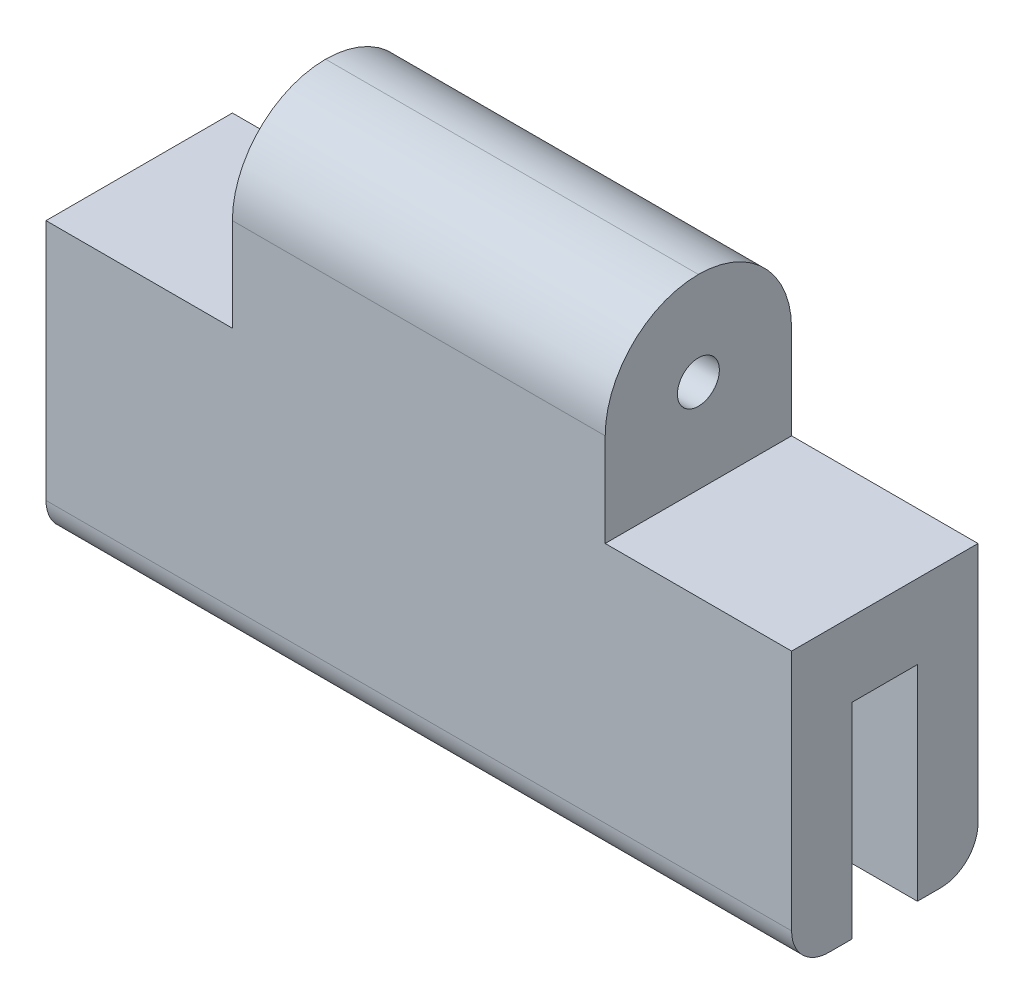
from build123d import *

# Parameters (mm, degrees)
SKETCH1_W           = 80
SKETCH1_H           = 20
BOSS_EXTRUDE1_DEPTH = 30
SKETCH2_W           = 80
SKETCH2_H           = 7
CUT_EXTRUDE1_DEPTH  = 22
SKETCH3_W           = 40
SKETCH3_H           = 20
BOSS_EXTRUDE2_DEPTH = 20
SKETCH4_R           = 2.25
CUT_EXTRUDE2_DEPTH  = 81.622577483
FILLET1_R           = 10
FILLET2_R           = 4


with BuildPart() as part:
    # Sketch1 → Boss-Extrude1 (new body)
    with BuildSketch(Plane(origin=(0, 0, 0), x_dir=(1, 0, 0), z_dir=(0, 1, 0))):
        with Locations((40, -10)):
            Rectangle(SKETCH1_W, SKETCH1_H)
    extrude(amount=BOSS_EXTRUDE1_DEPTH)

    # Sketch2 → Cut-Extrude1 (cut)
    with BuildSketch(Plane(origin=(0, 0, 0), x_dir=(-1, 0, 0), z_dir=(0, -1, 0))):
        with Locations((-40, -10)):
            Rectangle(SKETCH2_W, SKETCH2_H)
    extrude(amount=-CUT_EXTRUDE1_DEPTH, mode=Mode.SUBTRACT)

    # Sketch3 → Boss-Extrude2 (add)
    with BuildSketch(Plane(origin=(0, 30, 0), x_dir=(1, 0, 0), z_dir=(0, 1, 0))):
        with Locations((40, -10)):
            Rectangle(SKETCH3_W, SKETCH3_H)
    extrude(amount=BOSS_EXTRUDE2_DEPTH)

    # Sketch4 → Cut-Extrude2 (cut, through all)
    with BuildSketch(Plane.ZY.offset(-20)):
        with Locations((10, 40)):
            Circle(SKETCH4_R)
    extrude(amount=-CUT_EXTRUDE2_DEPTH, mode=Mode.SUBTRACT)

    # Fillet1
    fillet1_edges = [part.edges().sort_by_distance(p)[0] for p in [
        (40, 50, 0),
        (40, 50, 20),
    ]]
    fillet(fillet1_edges, radius=FILLET1_R - 0.0001)  # a hair under: the kernel refuses the full size

    # Fillet2
    fillet2_edges = [part.edges().sort_by_distance(p)[0] for p in [
        (40, 0, 0),
        (40, 0, 20),
    ]]
    fillet(fillet2_edges, radius=FILLET2_R)


solid = part.part
